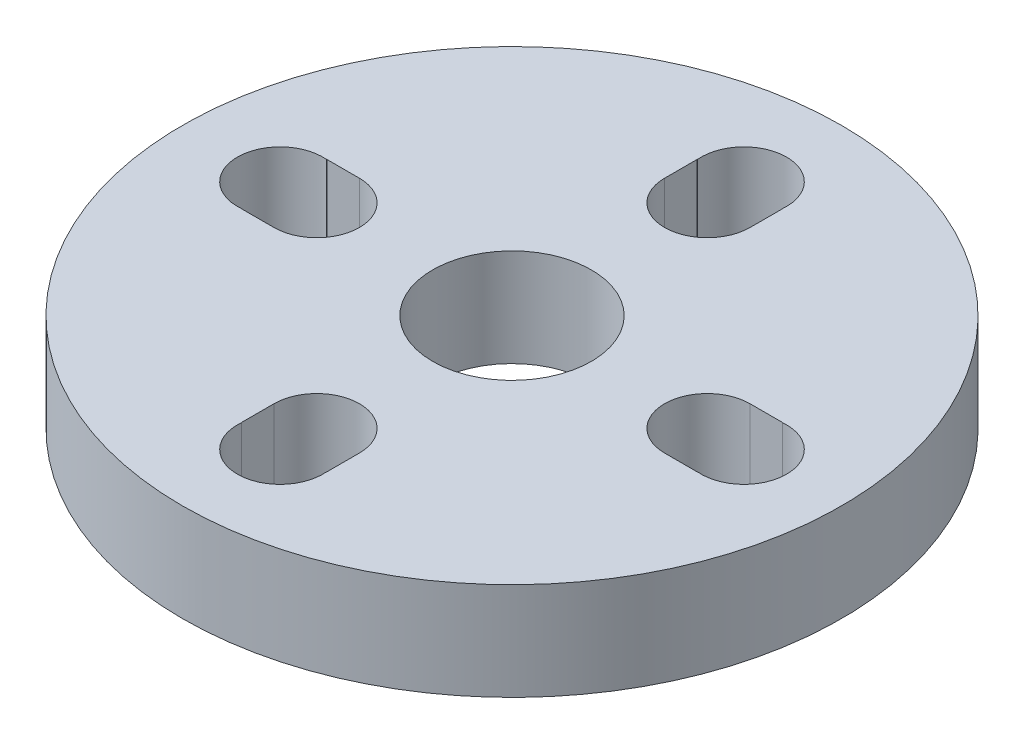
from build123d import *

# Parameters (mm, degrees)
SKETCH1_R           = 13.5
BOSS_EXTRUDE1_DEPTH = 4
CUT_EXTRUDE1_REACH  = 21.506
SKETCH2_R           = 3.25


with BuildPart() as part:
    # Sketch1 → Boss-Extrude1 (new body)
    with BuildSketch(Plane(origin=(0, 0, 0), x_dir=(1, 0, 0), z_dir=(0, 1, 0))):
        Circle(SKETCH1_R)
    extrude(amount=BOSS_EXTRUDE1_DEPTH)

    # Sketch2 → Cut-Extrude1 (cut, up to next)
    with BuildSketch(Plane(origin=(0, 4, 0), x_dir=(1, 0, 0), z_dir=(0, 1, 0)), mode=Mode.PRIVATE) as cut_extrude1_sk1:
        with BuildLine():
            ThreePointArc((-9.338815789, 1.742561233), (-11.25, 0), (-9.338815789, -1.742561233))
            ThreePointArc((-9.338815789, -1.742561233), (-9.338120985, -1.746280755), (-9.337424698, -1.75))
            Line((-9.337424698, -1.75), (-8, -1.75))
            ThreePointArc((-8, -1.75), (-6.25, 0), (-8, 1.75))
            Line((-8, 1.75), (-9.337424698, 1.75))
            ThreePointArc((-9.337424698, 1.75), (-9.338120985, 1.746280755), (-9.338815789, 1.742561233))
        make_face()
    cut_extrude1_tool1 = extrude(cut_extrude1_sk1.sketch, amount=-CUT_EXTRUDE1_REACH, mode=Mode.PRIVATE) & part.part
    # Sketch2 → Cut-Extrude1 (cut, up to next)
    with BuildSketch(Plane(origin=(0, 4, 0), x_dir=(1, 0, 0), z_dir=(0, 1, 0)), mode=Mode.PRIVATE) as cut_extrude1_sk2:
        with BuildLine():
            ThreePointArc((-1.742561233, 9.338815789), (-1.746280755, 9.338120985), (-1.75, 9.337424698))
            Line((-1.75, 9.337424698), (-1.75, 8))
            ThreePointArc((-1.75, 8), (0, 6.25), (1.75, 8))
            Line((1.75, 8), (1.75, 9.337424698))
            ThreePointArc((1.75, 9.337424698), (1.746280755, 9.338120985), (1.742561233, 9.338815789))
            ThreePointArc((1.742561233, 9.338815789), (0, 11.25), (-1.742561233, 9.338815789))
        make_face()
    cut_extrude1_tool2 = extrude(cut_extrude1_sk2.sketch, amount=-CUT_EXTRUDE1_REACH, mode=Mode.PRIVATE) & part.part
    # Sketch2 → Cut-Extrude1 (cut, up to next)
    with BuildSketch(Plane(origin=(0, 4, 0), x_dir=(1, 0, 0), z_dir=(0, 1, 0)), mode=Mode.PRIVATE) as cut_extrude1_sk3:
        with BuildLine():
            Line((-1.75, -8), (-1.75, -9.337424698))
            ThreePointArc((-1.75, -9.337424698), (-1.746280755, -9.338120985), (-1.742561233, -9.338815789))
            ThreePointArc((-1.742561233, -9.338815789), (0, -11.25), (1.742561233, -9.338815789))
            ThreePointArc((1.742561233, -9.338815789), (1.746280755, -9.338120985), (1.75, -9.337424698))
            Line((1.75, -9.337424698), (1.75, -8))
            ThreePointArc((1.75, -8), (0, -6.25), (-1.75, -8))
        make_face()
    cut_extrude1_tool3 = extrude(cut_extrude1_sk3.sketch, amount=-CUT_EXTRUDE1_REACH, mode=Mode.PRIVATE) & part.part
    # Sketch2 → Cut-Extrude1 (cut, up to next)
    with BuildSketch(Plane(origin=(0, 4, 0), x_dir=(1, 0, 0), z_dir=(0, 1, 0)), mode=Mode.PRIVATE) as cut_extrude1_sk4:
        with BuildLine():
            ThreePointArc((8, 1.75), (6.25, 0), (8, -1.75))
            Line((8, -1.75), (9.337424698, -1.75))
            ThreePointArc((9.337424698, -1.75), (9.338120985, -1.746280755), (9.338815789, -1.742561233))
            ThreePointArc((9.338815789, -1.742561233), (11.25, 0), (9.338815789, 1.742561233))
            ThreePointArc((9.338815789, 1.742561233), (9.338120985, 1.746280755), (9.337424698, 1.75))
            Line((9.337424698, 1.75), (8, 1.75))
        make_face()
    cut_extrude1_tool4 = extrude(cut_extrude1_sk4.sketch, amount=-CUT_EXTRUDE1_REACH, mode=Mode.PRIVATE) & part.part
    # Sketch2 → Cut-Extrude1 (cut, up to next)
    with BuildSketch(Plane(origin=(0, 4, 0), x_dir=(1, 0, 0), z_dir=(0, 1, 0)), mode=Mode.PRIVATE) as cut_extrude1_sk5:
        Circle(SKETCH2_R)
    cut_extrude1_tool5 = extrude(cut_extrude1_sk5.sketch, amount=-CUT_EXTRUDE1_REACH, mode=Mode.PRIVATE) & part.part
    add(cut_extrude1_tool1.solids().sort_by_distance((-8.749966, 4, 0))[0], mode=Mode.SUBTRACT)
    add(cut_extrude1_tool2.solids().sort_by_distance((0, 4, -8.749966))[0], mode=Mode.SUBTRACT)
    add(cut_extrude1_tool3.solids().sort_by_distance((0, 4, 8.749966))[0], mode=Mode.SUBTRACT)
    add(cut_extrude1_tool4.solids().sort_by_distance((8.749966, 4, 0))[0], mode=Mode.SUBTRACT)
    add(cut_extrude1_tool5.solids().sort_by_distance((0, 4, 0))[0], mode=Mode.SUBTRACT)


solid = part.part
